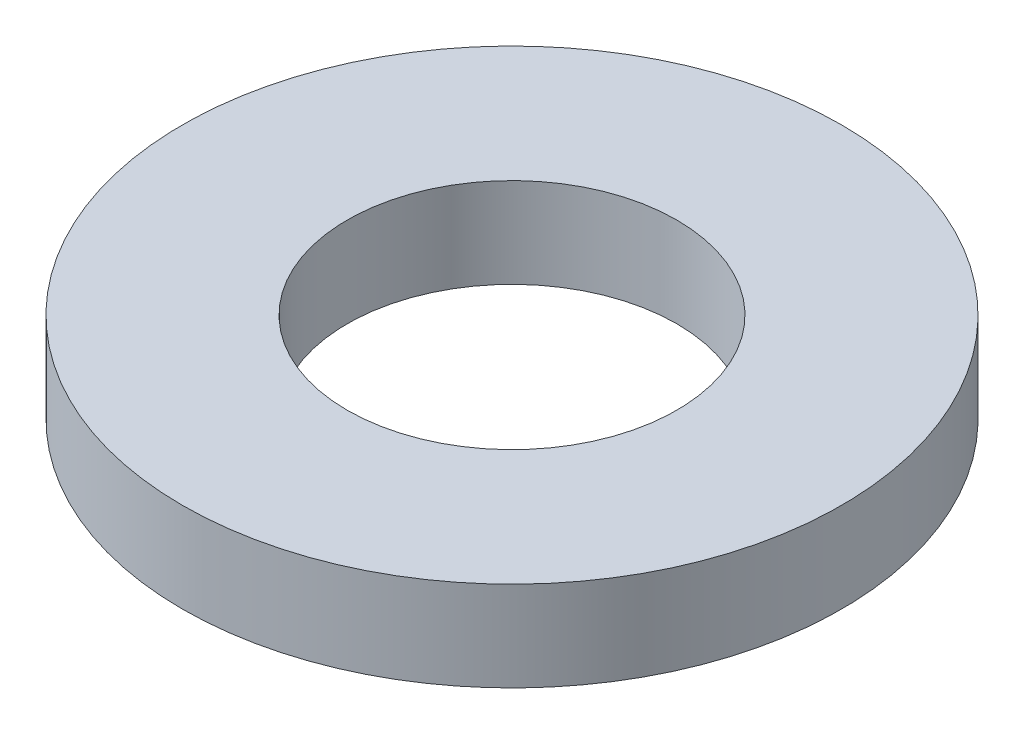
from build123d import *

# Parameters (mm, degrees)
SKETCH1_R           = 55
BOSS_EXTRUDE1_DEPTH = 15
SKETCH2_R           = 27.5
CUT_EXTRUDE1_DEPTH  = 80.214897589


with BuildPart() as part:
    # Sketch1 → Boss-Extrude1 (new body)
    with BuildSketch(Plane(origin=(0, 0, 0), x_dir=(1, 0, 0), z_dir=(0, 1, 0))):
        Circle(SKETCH1_R)
    extrude(amount=BOSS_EXTRUDE1_DEPTH)

    # Sketch2 → Cut-Extrude1 (cut, through all)
    with BuildSketch(Plane(origin=(0, 0, 0), x_dir=(1, 0, 0), z_dir=(0, 1, 0))):
        Circle(SKETCH2_R)
    extrude(amount=CUT_EXTRUDE1_DEPTH, mode=Mode.SUBTRACT)


solid = part.part
